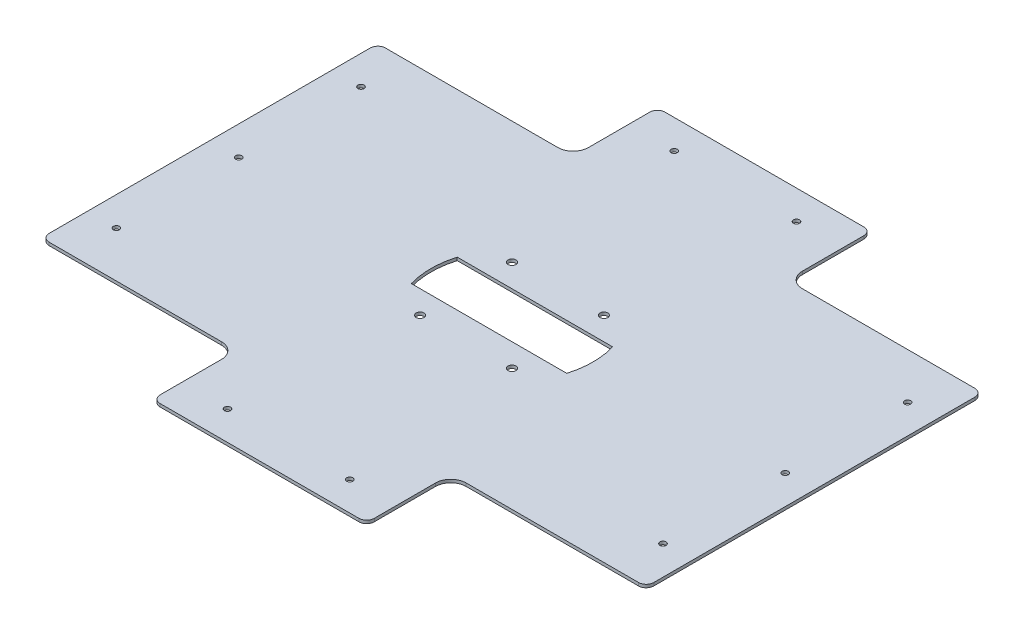
from build123d import *

# Parameters (mm, degrees)
SKETCH_1_R               = 2
EXTRUDE_1_DEPTH          = 2
CUT_EXTRUDE_2_DEPTH      = 258.635154254
PATTERN_CIRCULAR_1_COUNT = 4


with BuildPart() as part:
    # Эскиз1 → Бобышка-Вытянуть1 (new body)
    with BuildSketch(Plane(origin=(0, 0, 0), x_dir=(1, 0, 0), z_dir=(0, 1, 0))):
        with BuildLine():
            ThreePointArc((-70, -160.104291208), (-68.535533906, -163.639825114), (-65, -165.104291208))
            Line((-65, -165.104291208), (65, -165.104291208))
            ThreePointArc((65, -165.104291208), (68.535533906, -163.639825114), (70, -160.104291208))
            Line((70, -160.104291208), (70, -120))
            ThreePointArc((70, -120), (72.928932188, -112.928932188), (80, -110))
            Line((80, -110), (134.901841239, -110))
            Line((134.901841239, -110), (160.901841239, -110))
            Line((160.901841239, -110), (192.768667216, -110))
            ThreePointArc((192.768667216, -110), (196.304201122, -108.535533906), (197.768667216, -105))
            Line((197.768667216, -105), (197.768667216, 105))
            ThreePointArc((197.768667216, 105), (196.304201122, 108.535533906), (192.768667216, 110))
            Line((192.768667216, 110), (160.901841239, 110))
            Line((160.901841239, 110), (134.901841239, 110))
            Line((134.901841239, 110), (80, 110))
            ThreePointArc((80, 110), (72.928932188, 112.928932188), (70, 120))
            Line((70, 120), (70, 160.104291208))
            ThreePointArc((70, 160.104291208), (68.535533906, 163.639825114), (65, 165.104291208))
            Line((65, 165.104291208), (-65, 165.104291208))
            ThreePointArc((-65, 165.104291208), (-68.535533906, 163.639825114), (-70, 160.104291208))
            Line((-70, 160.104291208), (-70, 120))
            ThreePointArc((-70, 120), (-72.928932188, 112.928932188), (-80, 110))
            Line((-80, 110), (-192.768667216, 110))
            ThreePointArc((-192.768667216, 110), (-196.304201122, 108.535533906), (-197.768667216, 105))
            Line((-197.768667216, 105), (-197.768667216, -105))
            ThreePointArc((-197.768667216, -105), (-196.304201122, -108.535533906), (-192.768667216, -110))
            Line((-192.768667216, -110), (-80, -110))
            ThreePointArc((-80, -110), (-72.928932188, -112.928932188), (-70, -120))
            Line((-70, -120), (-70, -160.104291208))
        make_face()
        with Locations((-40, -146.104291208)):
            Circle(SKETCH_1_R, mode=Mode.SUBTRACT)
        with Locations((-178.768667216, -80)):
            Circle(SKETCH_1_R, mode=Mode.SUBTRACT)
        with Locations((-178.768667216, 0)):
            Circle(SKETCH_1_R, mode=Mode.SUBTRACT)
        with Locations((40, -146.104291208)):
            Circle(SKETCH_1_R, mode=Mode.SUBTRACT)
        with Locations((178.768667216, -80)):
            Circle(SKETCH_1_R, mode=Mode.SUBTRACT)
        with Locations((-178.768667216, 80)):
            Circle(SKETCH_1_R, mode=Mode.SUBTRACT)
        with Locations((-40, 146.104291208)):
            Circle(SKETCH_1_R, mode=Mode.SUBTRACT)
        with Locations((178.768667216, 0)):
            Circle(SKETCH_1_R, mode=Mode.SUBTRACT)
        with Locations((178.768667216, 80)):
            Circle(SKETCH_1_R, mode=Mode.SUBTRACT)
        with Locations((40, 146.104291208)):
            Circle(SKETCH_1_R, mode=Mode.SUBTRACT)
    extrude(amount=EXTRUDE_1_DEPTH)

    # Эскиз5 → Вырез-Вытянуть2 (cut, through all)
    with BuildSketch(Plane.XZ):
        with BuildLine():
            Line((50.833060109, -15), (-50.833060109, -15))
            ThreePointArc((-50.833060109, -15), (-53, 0), (-50.833060109, 15))
            Line((-50.833060109, 15), (50.833060109, 15))
            ThreePointArc((50.833060109, 15), (53, 0), (50.833060109, -15))
        make_face()
    extrude(amount=-CUT_EXTRUDE_2_DEPTH, mode=Mode.SUBTRACT)

    # Эскиз7 → Сверло под метчик  спиральное M51 (revolve, cut)
    with BuildSketch(Plane(origin=(30.0520382, 2, -30.0520382), x_dir=(0, 0, 1), z_dir=(1, 0, 0))):
        Polygon((0, 0), (0, 9.562237609), (2.6, 8), (2.6, 0), align=None)
    hole_wizard_m51 = revolve(axis=Axis((30.0520382, 8.35, -30.0520382), (0, -1, 0)), mode=Mode.SUBTRACT)

    # Круговой массив1: Сверло под метчик  спиральное M51 ×4 about axis
    pattern_circular_1_axis = Axis((0, 2, 0), (0, -1, 0))
    for i in range(1, PATTERN_CIRCULAR_1_COUNT):
        add(hole_wizard_m51.rotate(pattern_circular_1_axis, i * 360 / PATTERN_CIRCULAR_1_COUNT), mode=Mode.SUBTRACT)


solid = part.part
